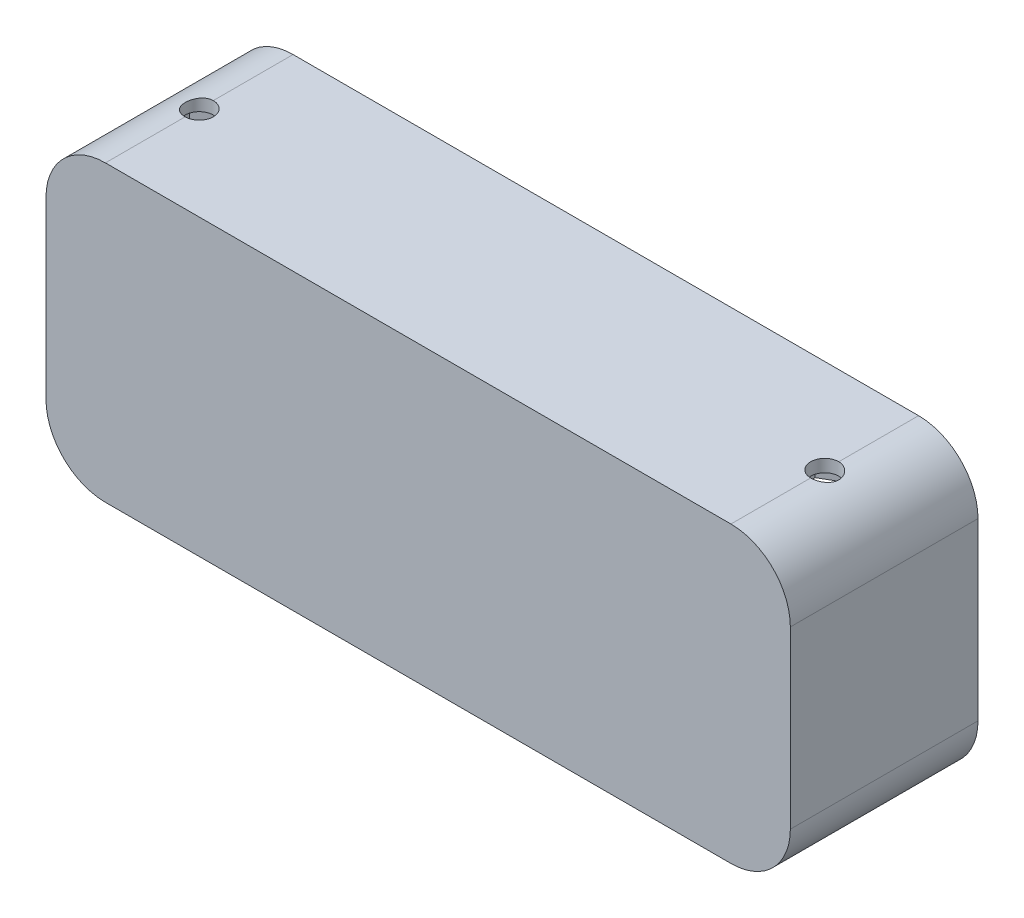
from build123d import *

# Parameters (mm, degrees)
BOSS_EXTRUDE1_DEPTH     = 28
CUT_EXTRUDE1_DEPTH      = 19
CUT_EXTRUDE1_DEPTH_BACK = 52
SKETCH3_R               = 2.75
BOSS_EXTRUDE2_DEPTH     = 2
SKETCH5_R               = 2.25
CUT_EXTRUDE2_DEPTH      = 50
CUT_EXTRUDE3_DEPTH      = 2
MIRROR3_COPY_1_DEPTH    = 2
SKETCH7_R               = 7.5
CUT_EXTRUDE4_DEPTH      = 10
BOSS_EXTRUDE3_DEPTH     = 4
CHAMFER1_SIZE           = 4
SKETCH9_R               = 3.3
SKETCH9_R_2             = 2.75
BOSS_EXTRUDE4_DEPTH     = 1.5
CHAMFER2_SIZE           = 1.5
CHAMFER3_SIZE           = 1.5
SKETCH10_W              = 16
SKETCH10_H              = 4
BOSS_EXTRUDE5_DEPTH     = 28


with BuildPart() as part:
    # Sketch2 → Boss-Extrude1 (new body)
    with BuildSketch(Plane.XY):
        with BuildLine():
            ThreePointArc((-59.5, 14), (-56.717514421, 20.717514421), (-50, 23.5))
            Line((-50, 23.5), (-36, 23.5))
            Line((-36, 23.5), (-36, -19.5))
            Line((-36, -19.5), (-24, -19.5))
            Line((-24, -19.5), (-24, 23.5))
            Line((-24, 23.5), (50, 23.5))
            ThreePointArc((50, 23.5), (56.717514421, 20.717514421), (59.5, 14))
            Line((59.5, 14), (59.5, -14))
            ThreePointArc((59.5, -14), (56.717514421, -20.717514421), (50, -23.5))
            Line((50, -23.5), (-50, -23.5))
            ThreePointArc((-50, -23.5), (-56.717514421, -20.717514421), (-59.5, -14))
            Line((-59.5, -14), (-59.5, 14))
        make_face()
        with BuildLine():
            ThreePointArc((50, -19.5), (53.889087297, -17.889087297), (55.5, -14))
            Line((55.5, -14), (55.5, 14))
            ThreePointArc((55.5, 14), (53.889087297, 17.889087297), (50, 19.5))
            Line((50, 19.5), (-20, 19.5))
            Line((-20, 19.5), (-20, -19.5))
            Line((-20, -19.5), (50, -19.5))
        make_face(mode=Mode.SUBTRACT)
        with BuildLine():
            Line((-55.5, -14), (-55.5, 14))
            ThreePointArc((-55.5, 14), (-53.889087297, 17.889087297), (-50, 19.5))
            Line((-50, 19.5), (-40, 19.5))
            Line((-40, 19.5), (-40, -19.5))
            Line((-40, -19.5), (-50, -19.5))
            ThreePointArc((-50, -19.5), (-53.889087297, -17.889087297), (-55.5, -14))
        make_face(mode=Mode.SUBTRACT)
    extrude(amount=BOSS_EXTRUDE1_DEPTH)

    # Sketch3 → Cut-Extrude1 (cut, two sides: drawn at the far end of the back side and taken through both)
    with BuildSketch(Plane(origin=(-36, 0, 0), x_dir=(0, 0, -1), z_dir=(1, 0, 0)).offset(-CUT_EXTRUDE1_DEPTH_BACK)):
        with Locations(Location((-14, 1.5, 0), (0, 0, 180))):
            Circle(SKETCH3_R)
    extrude(amount=CUT_EXTRUDE1_DEPTH + CUT_EXTRUDE1_DEPTH_BACK, mode=Mode.SUBTRACT)

    # Sketch4 → Boss-Extrude2 (add)
    with BuildSketch(Plane.XY.offset(28)):
        with BuildLine():
            Line((50, 23.5), (-36, 23.5))
            Line((-36, 23.5), (-50, 23.5))
            ThreePointArc((-50, 23.5), (-56.717514421, 20.717514421), (-59.5, 14))
            Line((-59.5, 14), (-59.5, -14))
            ThreePointArc((-59.5, -14), (-56.717514421, -20.717514421), (-50, -23.5))
            Line((-50, -23.5), (50, -23.5))
            ThreePointArc((50, -23.5), (56.717514421, -20.717514421), (59.5, -14))
            Line((59.5, -14), (59.5, 14))
            ThreePointArc((59.5, 14), (56.717514421, 20.717514421), (50, 23.5))
        make_face()
    extrude(amount=BOSS_EXTRUDE2_DEPTH)

    # Sketch5 → Cut-Extrude2 (cut)
    with BuildSketch(Plane(origin=(0, 23.5, 0), x_dir=(1, 0, 0), z_dir=(0, 1, 0))):
        with Locations(Location((-50, -15, 0), (0, 0, 270))):
            Circle(SKETCH5_R)
    cut_extrude2 = extrude(amount=-CUT_EXTRUDE2_DEPTH, mode=Mode.SUBTRACT)

    # Sketch6 → Cut-Extrude3 (cut, symmetric)
    with BuildSketch(Plane(origin=(0, -19.5, 0), x_dir=(1, 0, 0), z_dir=(0, 1, 0))):
        Polygon((-50, -19.272391992), (-46.3, -17.136195996), (-46.3, -12.863804004), (-50, -10.727608008), (-53.7, -12.863804004), (-53.7, -17.136195996), align=None)
    cut_extrude3 = extrude(amount=CUT_EXTRUDE3_DEPTH, both=True, mode=Mode.SUBTRACT)

    # Mirror1: Cut-Extrude2 across plane
    add(cut_extrude2.mirror(Plane(origin=(0, 0, 0), x_dir=(0, 0, 1), z_dir=(1, 0, 0))), mode=Mode.SUBTRACT)

    # Mirror2: Cut-Extrude3 across plane
    add(cut_extrude3.mirror(Plane.ZX), mode=Mode.SUBTRACT)

    # Mirror3: Cut-Extrude3 across plane
    add(cut_extrude3.mirror(Plane(origin=(0, 0, 0), x_dir=(0, 0, 1), z_dir=(1, 0, 0))), mode=Mode.SUBTRACT)

    # Mirror3 copy 1 sketch → Mirror3 copy 1 (cut, symmetric)
    with BuildSketch(Plane(origin=(0, 19.5, 0), x_dir=(-1, 0, 0), z_dir=(0, -1, 0))):
        Polygon((-50, -19.272391992), (-46.3, -17.136195996), (-46.3, -12.863804004), (-50, -10.727608008), (-53.7, -12.863804004), (-53.7, -17.136195996), align=None)
    extrude(amount=MIRROR3_COPY_1_DEPTH, both=True, mode=Mode.SUBTRACT)

    # Sketch7 → Cut-Extrude4 (cut)
    with BuildSketch(Plane.ZY.offset(59.5)):
        with Locations((14, 1.5)):
            Circle(SKETCH7_R)
    extrude(amount=-CUT_EXTRUDE4_DEPTH, mode=Mode.SUBTRACT)

    # Sketch8 → Boss-Extrude3 (add)
    with BuildSketch(Plane(origin=(-20, 0, 0), x_dir=(0, 0, -1), z_dir=(1, 0, 0))):
        Polygon((-5.628421097, 1.5), (-9.814210548, 8.75), (-18.185789452, 8.75), (-22.371578903, 1.5), (-18.185789452, -5.75), (-9.814210548, -5.75), align=None)
        Polygon((-9.092522712, 1.5), (-11.546261356, 5.75), (-16.453738644, 5.75), (-18.907477288, 1.5), (-16.453738644, -2.75), (-11.546261356, -2.75), align=None, mode=Mode.SUBTRACT)
    extrude(amount=BOSS_EXTRUDE3_DEPTH)

    # Chamfer1
    chamfer1_edges = [part.edges().sort_by_distance(p)[0] for p in [
        (-20, 5.125, 7.721315823),
        (-20, 8.75, 14),
        (-20, 5.125, 20.278684177),
        (-20, -2.125, 20.278684177),
        (-20, -5.75, 14),
        (-20, -2.125, 7.721315823),
    ]]
    chamfer(chamfer1_edges, length=CHAMFER1_SIZE - 0.0001)  # a hair under: the kernel refuses the full size

    # Sketch9 → Boss-Extrude4 (add)
    with BuildSketch(Plane.ZY.offset(24)):
        with Locations((14, 1.5)):
            Circle(SKETCH9_R)
        with Locations((14, 1.5)):
            Circle(SKETCH9_R_2, mode=Mode.SUBTRACT)
    boss_extrude4 = extrude(amount=BOSS_EXTRUDE4_DEPTH)

    # Chamfer2
    chamfer2_edges = [part.edges().sort_by_distance(p)[0] for p in [
        (-24, 1.5, 10.7),
    ]]
    chamfer(chamfer2_edges, length=CHAMFER2_SIZE - 0.0001)  # a hair under: the kernel refuses the full size

    # Mirror6: Boss-Extrude4 across plane
    add(boss_extrude4.mirror(Plane(origin=(-30, 0, 0), x_dir=(0, 0, 1), z_dir=(1, 0, 0))))

    # Chamfer3
    chamfer3_edges = [part.edges().sort_by_distance(p)[0] for p in [
        (-36, 1.5, 10.7),
    ]]
    chamfer(chamfer3_edges, length=CHAMFER3_SIZE - 0.0001)  # a hair under: the kernel refuses the full size

    # Sketch10 → Boss-Extrude5 (add)
    with BuildSketch(Plane(origin=(0, 0, 0), x_dir=(-1, 0, 0), z_dir=(0, 0, -1))):
        with Locations((32, 21.5)):
            Rectangle(SKETCH10_W, SKETCH10_H)
    extrude(amount=-BOSS_EXTRUDE5_DEPTH)


solid = part.part
